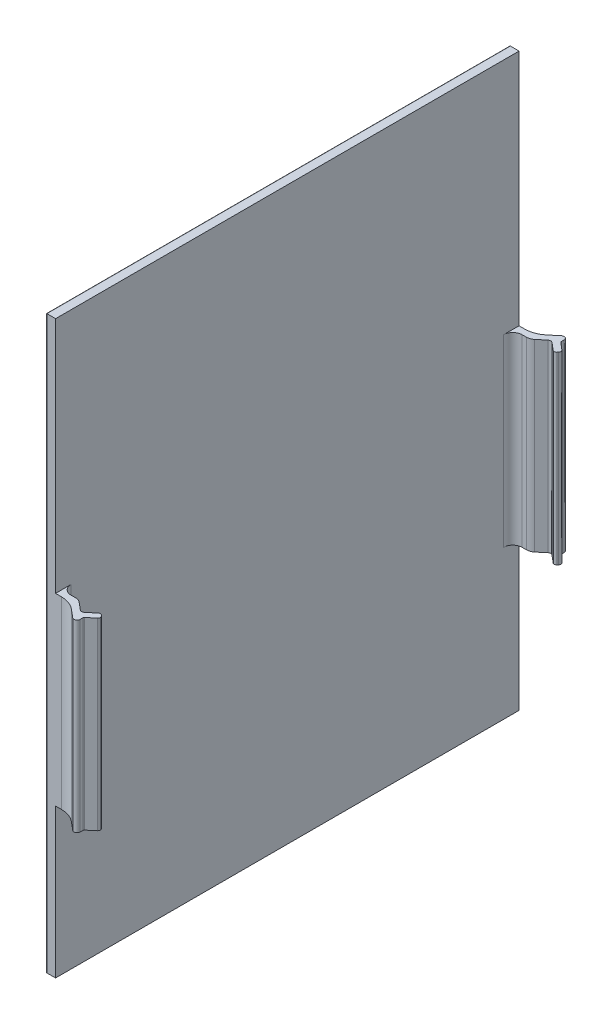
from build123d import *

# Parameters (mm, degrees)
STOCK_OUTTER_CASE_1_START     = -75
STOCK_OUTTER_CASE_1_OUTLINE_W = 3
STOCK_OUTTER_CASE_1_OUTLINE_H = 184.8
STOCK_OUTTER_CASE_1_DEPTH     = 150
FILLET1_R                     = 0.2
BOSS_EXTRUDE1_DEPTH           = 29.8


# Read off the part's stored shape, not the designer's step: Stock-outter_case-1
with BuildPart() as part:
    # Stock-outter_case-1 outline → Stock-outter_case-1 (new body)
    with BuildSketch(Plane.XY.offset(STOCK_OUTTER_CASE_1_START)):
        with Locations((-154.5, 88.4)):
            Rectangle(STOCK_OUTTER_CASE_1_OUTLINE_W, STOCK_OUTTER_CASE_1_OUTLINE_H)
    extrude(amount=STOCK_OUTTER_CASE_1_DEPTH)

    # Fillet1
    fillet1_edges = [part.edges().sort_by_distance(p)[0] for p in [
        (-156, 180.8, 0),
        (-156, -4, 0),
        (-156, 88.4, 75),
        (-156, 88.4, -75),
    ]]
    fillet(fillet1_edges, radius=FILLET1_R)

    # Sketch1 → Boss-Extrude1 (add, symmetric)
    with BuildSketch(Plane(origin=(0, 74, 0), x_dir=(1, 0, 0), z_dir=(0, 1, 0))):
        with BuildLine():
            Line((-153, 75), (-151.139702343, 75))
            ThreePointArc((-151.139702343, 75), (-148.403541196, 75.482459034), (-145.997401465, 76.871644455))
            Line((-145.997401465, 76.871644455), (-143.384202565, 79.064378688))
            ThreePointArc((-143.384202565, 79.064378688), (-142.318796694, 79.204642032), (-141.741414955, 78.298334245))
            Line((-141.741414955, 78.298334245), (-141.741414955, 77.439817918))
            ThreePointArc((-141.741414955, 77.439817918), (-141.694568849, 77.228508787), (-141.56280876, 77.056795696))
            Line((-141.56280876, 77.056795696), (-139.290072737, 75.149743737))
            ThreePointArc((-139.290072737, 75.149743737), (-139.007347067, 74.606632777), (-139.191467271, 74.022678095))
            Line((-139.191467271, 74.022678095), (-139.448582314, 73.716260318))
            ThreePointArc((-139.448582314, 73.716260318), (-139.991693275, 73.433534647), (-140.575647957, 73.617654851))
            Line((-140.575647957, 73.617654851), (-143.026990175, 75.674575202))
            ThreePointArc((-143.026990175, 75.674575202), (-143.669777784, 75.908530759), (-144.312565394, 75.674575202))
            Line((-144.312565394, 75.674575202), (-146.663547874, 73.701866671))
            ThreePointArc((-146.663547874, 73.701866671), (-147.565850273, 73.180922138), (-148.591910703, 73))
            Line((-148.591910703, 73), (-150, 73))
            ThreePointArc((-150, 73), (-152.121320344, 72.121320344), (-153, 70))
            Line((-153, 70), (-153, 75))
        make_face()
    boss_extrude1 = extrude(amount=BOSS_EXTRUDE1_DEPTH, both=True)

    # Mirror1: Boss-Extrude1 across plane
    add(boss_extrude1.mirror(Plane.XY))


solid = part.part
